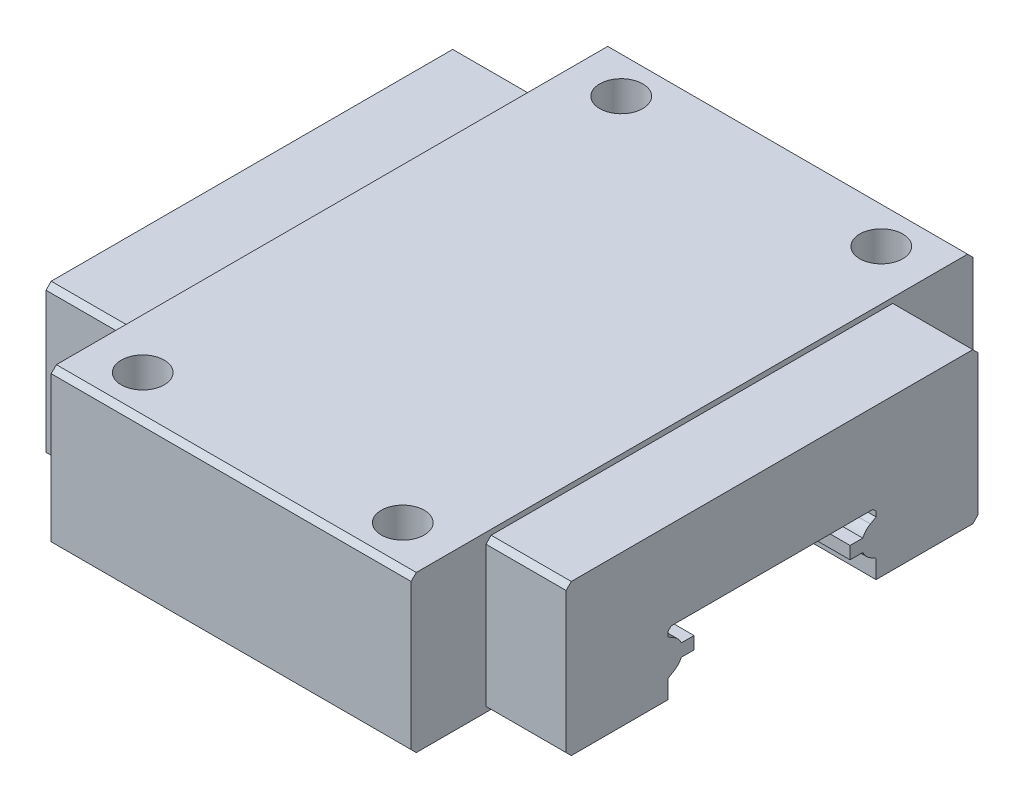
from build123d import *

# Parameters (mm, degrees)
SKETCH1_W               = 39.6
SKETCH1_H               = 14.5
BOSS_EXTRUDE1_DEPTH     = 25
SKETCH2_W               = 54
SKETCH2_H               = 15
BOSS_EXTRUDE2_DEPTH     = 17.3
CUT_EXTRUDE1_DEPTH      = 42.880783183
CUT_EXTRUDE1_DEPTH_BACK = 42.880783183
CHAMFER1_SIZE           = 0.5
CHAMFER2_SIZE           = 0.5
CHAMFER3_SIZE           = 0.5
CHAMFER4_SIZE           = 0.5
TAP1_D                  = 4.134
LPATTERN1_COUNT         = 2
LPATTERN1_PITCH         = 25
LPATTERN1_COUNT_DIR2    = 2
LPATTERN1_PITCH_DIR2    = 46


with BuildPart() as part:
    # Sketch1 → Boss-Extrude1 (new, symmetric)
    with BuildSketch(Plane(origin=(0, 0, 0), x_dir=(0, 0, -1), z_dir=(1, 0, 0))):
        with Locations((0, 12.25)):
            Rectangle(SKETCH1_W, SKETCH1_H)
    extrude(amount=BOSS_EXTRUDE1_DEPTH, both=True)

    # Sketch2 → Boss-Extrude2 (add, symmetric)
    with BuildSketch(Plane(origin=(0, 0, 0), x_dir=(0, 0, -1), z_dir=(1, 0, 0))):
        with Locations((0, 12.5)):
            Rectangle(SKETCH2_W, SKETCH2_H)
    extrude(amount=BOSS_EXTRUDE2_DEPTH, both=True)

    # Sketch3 → Cut-Extrude1 (cut, two sides: drawn at the far end of the back side and taken through both)
    with BuildSketch(Plane(origin=(0, 0, 0), x_dir=(0, 0, -1), z_dir=(1, 0, 0)).offset(-CUT_EXTRUDE1_DEPTH_BACK)):
        with BuildLine():
            Line((-9.7, 11), (9.7, 11))
            Line((9.7, 11), (10, 10.7))
            Line((10, 10.7), (10, 10.221039482))
            Line((10, 10.221039482), (9.455259378, 9.911421591))
            ThreePointArc((9.455259378, 9.911421591), (9.0228024, 9.564639684), (8.720500078, 9.1))
            Line((8.720500078, 9.1), (7.5, 9.1))
            Line((7.5, 9.1), (7.5, 7.9))
            Line((7.5, 7.9), (8.724976489, 7.9))
            ThreePointArc((8.724976489, 7.9), (9.018551739, 7.450071616), (9.434780564, 7.110401858))
            Line((9.434780564, 7.110401858), (10, 6.778960518))
            Line((10, 6.778960518), (10, 0))
            Line((10, 0), (-10, 0))
            Line((-10, 0), (-10, 6.778960518))
            Line((-10, 6.778960518), (-9.434780564, 7.110401858))
            ThreePointArc((-9.434780564, 7.110401858), (-9.018551739, 7.450071616), (-8.724976489, 7.9))
            Line((-8.724976489, 7.9), (-7.5, 7.9))
            Line((-7.5, 7.9), (-7.5, 9.1))
            Line((-7.5, 9.1), (-8.720500078, 9.1))
            ThreePointArc((-8.720500078, 9.1), (-9.0228024, 9.564639684), (-9.455259378, 9.911421591))
            Line((-9.455259378, 9.911421591), (-10, 10.221039482))
            Line((-10, 10.221039482), (-10, 10.7))
            Line((-10, 10.7), (-9.7, 11))
        make_face()
    extrude(amount=CUT_EXTRUDE1_DEPTH + CUT_EXTRUDE1_DEPTH_BACK, mode=Mode.SUBTRACT)

    # Chamfer1
    chamfer1_edges = [part.edges().sort_by_distance(p)[0] for p in [
        (-21.15, 19.5, 19.8),
        (-21.15, 19.5, -19.8),
        (21.15, 19.5, 19.8),
        (21.15, 19.5, -19.8),
    ]]
    chamfer(chamfer1_edges, length=CHAMFER1_SIZE)

    # Chamfer2
    chamfer2_edges = [part.edges().sort_by_distance(p)[0] for p in [
        (0, 20, 27),
        (0, 20, -27),
    ]]
    chamfer(chamfer2_edges, length=CHAMFER2_SIZE)

    # Chamfer3
    chamfer3_edges = [part.edges().sort_by_distance(p)[0] for p in [
        (-21.15, 5, -19.8),
        (-21.15, 5, 19.8),
        (21.15, 5, -19.8),
        (21.15, 5, 19.8),
    ]]
    chamfer(chamfer3_edges, length=CHAMFER3_SIZE)

    # Chamfer4
    chamfer4_edges = [part.edges().sort_by_distance(p)[0] for p in [
        (0, 5, 27),
        (0, 5, -27),
    ]]
    chamfer(chamfer4_edges, length=CHAMFER4_SIZE)

    # Tap1 (through all)
    with Locations(Plane(origin=(0, 20, 0), x_dir=(1, 0, 0), z_dir=(0, 1, 0))):
        with Locations((-12.5, 23)):
            tap1 = Hole(TAP1_D / 2)

    # LPattern1: Tap1 2 × 2
    with Locations(*[(i * LPATTERN1_PITCH, 0, j * LPATTERN1_PITCH_DIR2) for i in range(LPATTERN1_COUNT) for j in range(LPATTERN1_COUNT_DIR2) if (i, j) != (0, 0)]):
        add(tap1, mode=Mode.SUBTRACT)


solid = part.part
